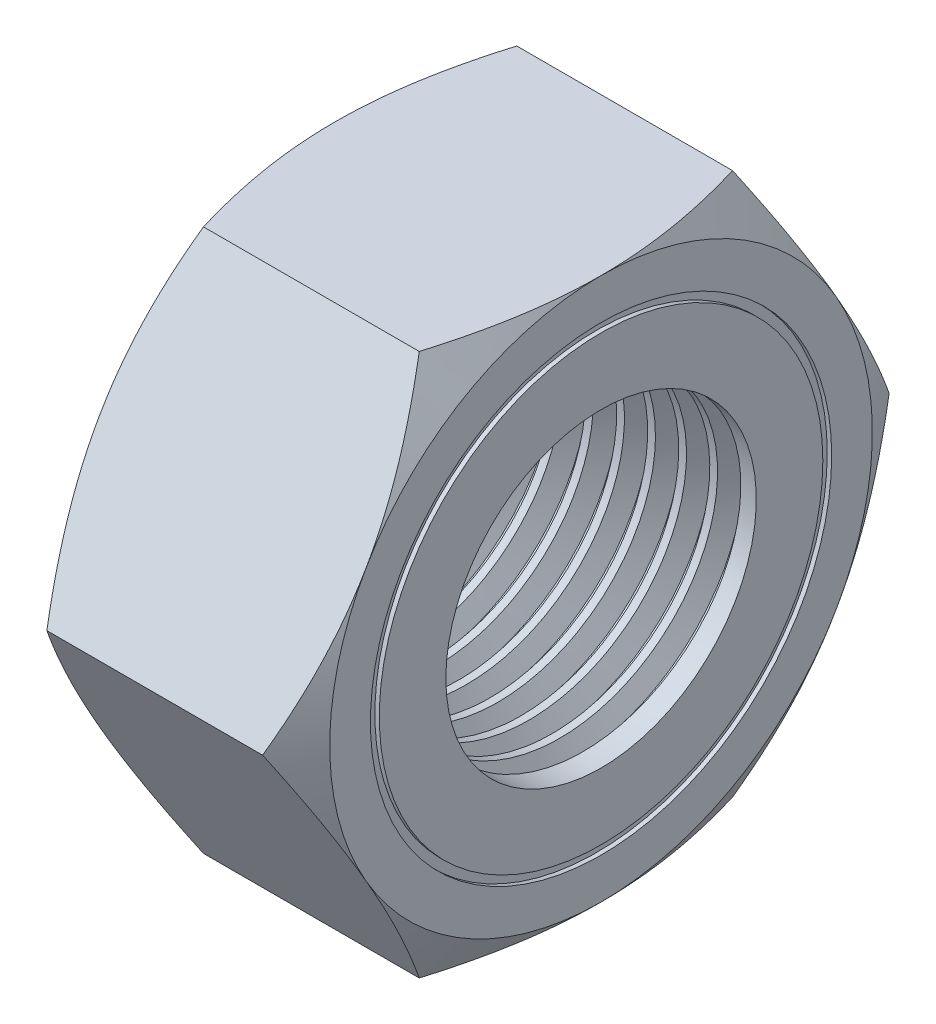
from build123d import *

# Parameters (mm, degrees)
SKETCH1_R           = 3.5
BOSS_EXTRUDE1_DEPTH = 6
SKETCH3_R           = 5.2
SKETCH3_R_2         = 5
CUT_EXTRUDE1_DEPTH  = 0.1
THREAD1_PITCH       = 0.7


with BuildPart() as part:
    # Sketch1 → Boss-Extrude1 (new body)
    with BuildSketch(Plane(origin=(0, 0, 0), x_dir=(0, 0, -1), z_dir=(1, 0, 0))):
        Polygon((7.063333004, 0), (3.531666502, 6.117025817), (-3.531666502, 6.117025817), (-7.063333004, 0), (-3.531666502, -6.117025817), (3.531666502, -6.117025817), align=None)
        Circle(SKETCH1_R, mode=Mode.SUBTRACT)
    extrude(amount=BOSS_EXTRUDE1_DEPTH)

    # Sketch2 → Cut-Revolve1 (revolve, cut)
    with BuildSketch(Plane.XY):
        Polygon((6, 6.117025817), (6, 8.117025817), (4.8, 8.117025817), align=None)
        Polygon((1.2, 8.117025817), (0, 6.117025817), (0, 8.117025817), align=None)
    revolve(axis=Axis((0, 0, 0), (-1, 0, 0)), mode=Mode.SUBTRACT)

    # Sketch3 → Cut-Extrude1 (cut)
    with BuildSketch(Plane(origin=(6, 0, 0), x_dir=(0, 0, -1), z_dir=(1, 0, 0))):
        Circle(SKETCH3_R)
        Circle(SKETCH3_R_2, mode=Mode.SUBTRACT)
    extrude(amount=-CUT_EXTRUDE1_DEPTH, mode=Mode.SUBTRACT)

    # Thread1: the profile of Thread Profile1 profile screwed along a right-hand helix of 10 turns, 6 arcs to a turn; built about Z, then put on its axis
    thread1_z = Axis((0, 0, 0), (0, 0, 1))
    thread1_corners = [(3.4997, 0, -0.000173205), (3.878886113, 0, 0.218749999), (3.878886113, 0, 0.306249999), (3.4997, 0, 0.525173203)]
    with BuildLine(mode=Mode.PRIVATE) as thread1_profile:
        Line(thread1_corners[0], thread1_corners[1])
        Line(thread1_corners[1], thread1_corners[2])
        Line(thread1_corners[2], thread1_corners[3])
        Line(thread1_corners[3], thread1_corners[0])
    thread1_cap = Face(thread1_profile.wire())
    thread1_turn_angles = [0, 30, 60, 90, 120, 150, 180, 210, 240, 270, 300, 330, 360]
    thread1_turn_weights = [1, 0.8660254037844387, 1, 0.8660254037844387, 1, 0.8660254037844387, 1, 0.8660254037844387, 1, 0.8660254037844387, 1, 0.8660254037844387, 1]
    thread1_turn_rails = [Edge.make_bspline([Vector(p[0], p[1], 0).rotate(thread1_z, thread1_turn_angles[k]) / thread1_turn_weights[k] + Vector(0, 0, p[2] + THREAD1_PITCH * thread1_turn_angles[k] / 360) for k in range(13)], [0, 0, 0, 1, 1, 2, 2, 3, 3, 4, 4, 5, 5, 6, 6, 6], 2, thread1_turn_weights) for p in thread1_corners]
    thread1_turn_sides = [Face.make_surface_from_curves(thread1_turn_rails[p[0]], thread1_turn_rails[p[1]]) for p in [(0, 1), (1, 2), (2, 3), (3, 0)]]
    thread1 = Plane(origin=(6, 0, 0), x_dir=(0, 0, 1), z_dir=(-1, 0, 0)) * Solid(Shell([*[p.moved(Location((0, 0, THREAD1_PITCH * i))) for i in range(10) for p in thread1_turn_sides], thread1_cap, thread1_cap.rotate(thread1_z, 3600).moved(Location((0, 0, THREAD1_PITCH * 3600 / 360)))]))
    add(thread1, mode=Mode.SUBTRACT)


solid = part.part
